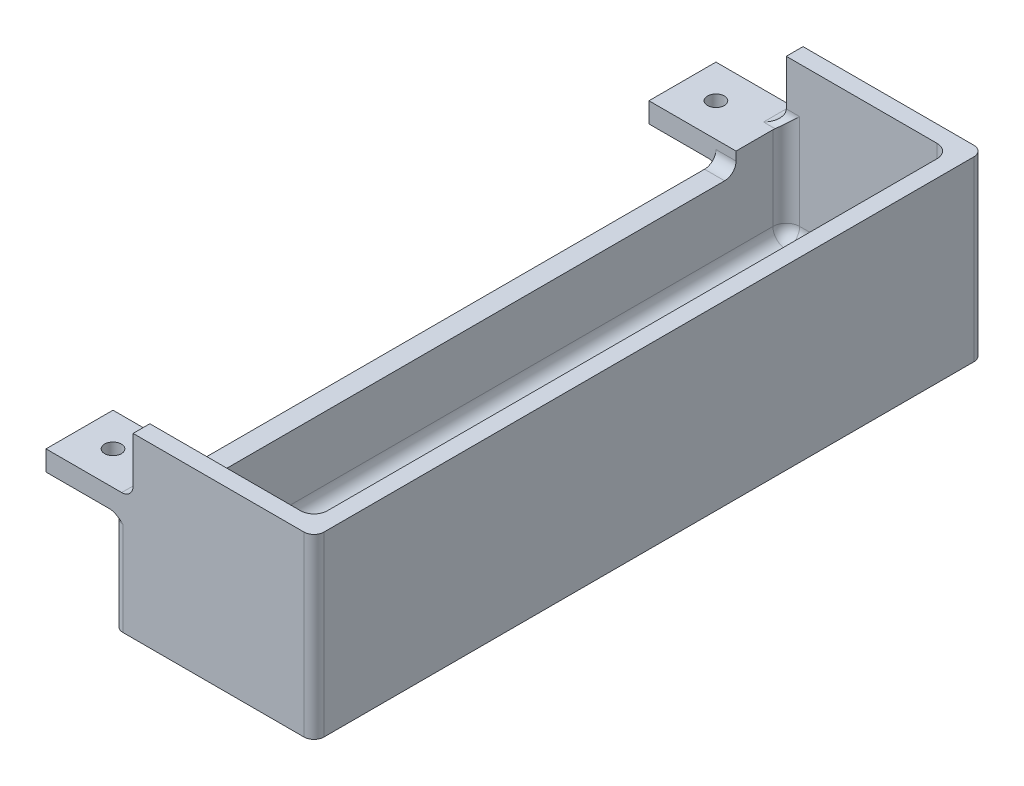
from build123d import *

# Parameters (mm, degrees)
BOSS_EXTRUDE1_DEPTH = 4.445
SKETCH2_W           = 127
SKETCH2_H           = 19.05
BOSS_EXTRUDE2_DEPTH = 3.81
SKETCH3_W           = 16.51
SKETCH3_H           = 3.81
BOSS_EXTRUDE3_DEPTH = 12.7
SKETCH4_R           = 1.5875
CUT_EXTRUDE1_DEPTH  = 78.501223216
WALLS_DEPTH         = 29.21
FILLET5_R           = 2.54
FILLET7_R           = 1.905
FILLET8_R           = 2.159
FILLET9_R           = 1.27


with BuildPart() as part:
    # Sketch1 → Boss-Extrude1 (new body)
    with BuildSketch(Plane(origin=(0, 0, 0), x_dir=(1, 0, 0), z_dir=(0, 1, 0))):
        Polygon((0, -63.5), (0, 63.5), (3.81, 63.5), (38.1, 63.5), (38.1, -63.5), (3.81, -63.5), align=None)
    extrude(amount=BOSS_EXTRUDE1_DEPTH)

    # Sketch2 → Boss-Extrude2 (add)
    with BuildSketch(Plane.ZY):
        with Locations((0, 9.525)):
            Rectangle(SKETCH2_W, SKETCH2_H)
    extrude(amount=-BOSS_EXTRUDE2_DEPTH)

    # Sketch3 → Boss-Extrude3 (add)
    with BuildSketch(Plane.XY.offset(63.5)):
        with Locations((-4.445, 20.955)):
            Rectangle(SKETCH3_W, SKETCH3_H)
    boss_extrude3 = extrude(amount=-BOSS_EXTRUDE3_DEPTH)

    # Mirror1: Boss-Extrude3 across plane
    add(boss_extrude3.mirror(Plane.XY))

    # Sketch4 → Cut-Extrude1 (cut, through all)
    with BuildSketch(Plane(origin=(0, 22.86, 0), x_dir=(1, 0, 0), z_dir=(0, 1, 0))):
        with Locations(Location((-6.35, 57.15, 0), (0, 0, 270))):
            Circle(SKETCH4_R)
        with Locations((-6.35, -57.15)):
            Circle(SKETCH4_R)
    extrude(amount=-CUT_EXTRUDE1_DEPTH, mode=Mode.SUBTRACT)

    # Sketch6 → Walls (add)
    with BuildSketch(Plane(origin=(0, 4.445, 0), x_dir=(1, 0, 0), z_dir=(0, 1, 0))):
        Polygon((3.81, 63.5), (38.1, 63.5), (38.1, -63.5), (3.81, -63.5), (3.81, -60.325), (34.925, -60.325), (34.925, 0), (34.925, 60.325), (3.81, 60.325), align=None)
    extrude(amount=WALLS_DEPTH)

    # Fillet5
    fillet5_edges = [part.edges().sort_by_distance(p)[0] for p in [
        (3.81, 4.445, 0),
        (3.81, 13.6525, 60.325),
        (19.3675, 4.445, -60.325),
        (3.81, 13.6525, -60.325),
        (34.925, 4.445, 0),
        (34.925, 19.05, -60.325),
        (19.3675, 4.445, 60.325),
        (34.925, 19.05, 60.325),
    ]]
    fillet(fillet5_edges, radius=FILLET5_R)

    # Fillet7
    fillet7_edges = [part.edges().sort_by_distance(p)[0] for p in [
        (38.1, 16.8275, -63.5),
        (38.1, 16.8275, 63.5),
        (0, 9.525, 63.5),
        (0, 9.525, -63.5),
    ]]
    fillet(fillet7_edges, radius=FILLET7_R)

    # Fillet8
    fillet8_edges = [part.edges().sort_by_distance(p)[0] for p in [
        (5.08, 22.86, 60.325),
        (5.08, 22.86, -60.325),
        (1.905, 19.05, 50.8),
        (1.905, 19.05, -50.8),
        (3.81, 22.86, -61.9125),
        (3.81, 22.86, 61.9125),
    ]]
    fillet(fillet8_edges, radius=FILLET8_R)

    # Fillet9
    # the kernel refuses this fillet: 1.27 mm, written as the material it adds along each edge
    with BuildSketch(Plane(origin=(0, 19.05, 50.8), x_dir=(-1, 0, 0), z_dir=(0, 0, 1)), Plane(origin=(0, 19.05, -61.595), x_dir=(-1, 0, 0), z_dir=(0, 0, 1))) as fillet9_piece_1:
        with BuildLine():
            CenterArc((FILLET9_R, FILLET9_R), FILLET9_R, 180, 90)
            Line((0, FILLET9_R), (0, 0))
            Line((0, 0), (FILLET9_R, 0))
        make_face()
    extrude(amount=10.795)
    with BuildSketch(Plane(origin=(1.905, 19.05, -61.595), x_dir=(0.995343646445092, 0, 0.09638996566752997), z_dir=(-0.09638996566752997, 0, 0.995343646445092))) as fillet9_piece_2_section:
        with BuildLine():
            CenterArc((1.905 + FILLET9_R, -FILLET9_R), FILLET9_R, 90, 90)
            Line((1.905, -FILLET9_R), (1.905, 0))
            Line((1.905, 0), (1.905 + FILLET9_R, 0))
        make_face()
    fillet9_piece_2 = revolve(axis=Axis((1.905, 19.05, -61.595), (0, 1, 0)), revolution_arc=185.531326158, mode=Mode.PRIVATE)
    fillet9_piece_2 = split(fillet9_piece_2, bisect_by=Plane(origin=(1.905, 19.05, -63.5), z_dir=(0, 0, 1)), keep=Keep.TOP, mode=Mode.PRIVATE)
    add(fillet9_piece_2)
    with BuildSketch(Plane(origin=(1.905, 19.05, 61.595), x_dir=(0.995343646445092, 0, -0.09638996566752997), z_dir=(-0.09638996566752997, 0, -0.995343646445092))) as fillet9_piece_3_section:
        with BuildLine():
            CenterArc((1.905 + FILLET9_R, FILLET9_R), FILLET9_R, 180, 90)
            Line((1.905 + FILLET9_R, 0), (1.905, 0))
            Line((1.905, 0), (1.905, FILLET9_R))
        make_face()
    fillet9_piece_3 = revolve(axis=Axis((1.905, 19.05, 61.595), (0, -1, 0)), revolution_arc=185.531326158, mode=Mode.PRIVATE)
    fillet9_piece_3 = split(fillet9_piece_3, bisect_by=Plane(origin=(1.905, 19.05, 63.5), z_dir=(0, 0, -1)), keep=Keep.TOP, mode=Mode.PRIVATE)
    add(fillet9_piece_3)


solid = part.part
